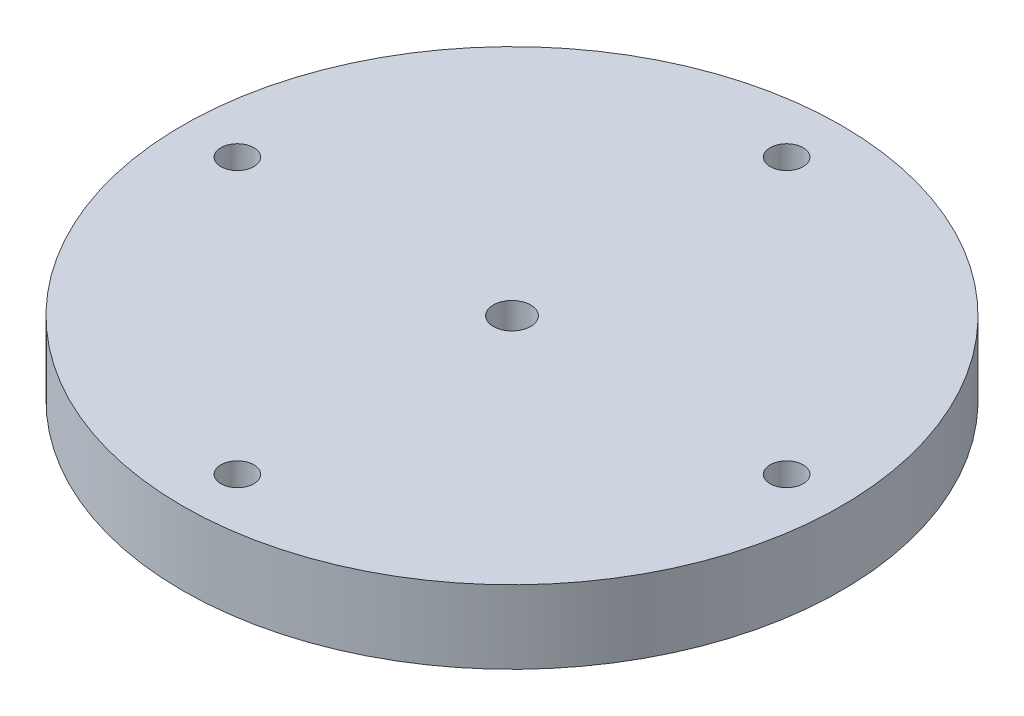
from build123d import *

# Parameters (mm, degrees)
SKETCH1_R           = 45
BOSS_EXTRUDE1_DEPTH = 10
SKETCH2_R           = 2.25
CUT_EXTRUDE1_DEPTH  = 65.420493634
SKETCH3_R           = 2.55
CUT_EXTRUDE2_DEPTH  = 65.420493634


with BuildPart() as part:
    # Sketch1 → Boss-Extrude1 (new body)
    with BuildSketch(Plane(origin=(0, 0, 0), x_dir=(1, 0, 0), z_dir=(0, 1, 0))):
        Circle(SKETCH1_R)
    extrude(amount=BOSS_EXTRUDE1_DEPTH)

    # Sketch2 → Cut-Extrude1 (cut, through all)
    with BuildSketch(Plane(origin=(0, 10, 0), x_dir=(1, 0, 0), z_dir=(0, 1, 0))):
        with Locations((0, 37.5)):
            Circle(SKETCH2_R)
        with Locations((-37.5, 0)):
            Circle(SKETCH2_R)
        with Locations((0, -37.5)):
            Circle(SKETCH2_R)
        with Locations((37.5, 0)):
            Circle(SKETCH2_R)
    extrude(amount=-CUT_EXTRUDE1_DEPTH, mode=Mode.SUBTRACT)

    # Sketch3 → Cut-Extrude2 (cut, through all)
    with BuildSketch(Plane(origin=(0, 10, 0), x_dir=(1, 0, 0), z_dir=(0, 1, 0))):
        Circle(SKETCH3_R)
    extrude(amount=-CUT_EXTRUDE2_DEPTH, mode=Mode.SUBTRACT)


solid = part.part
